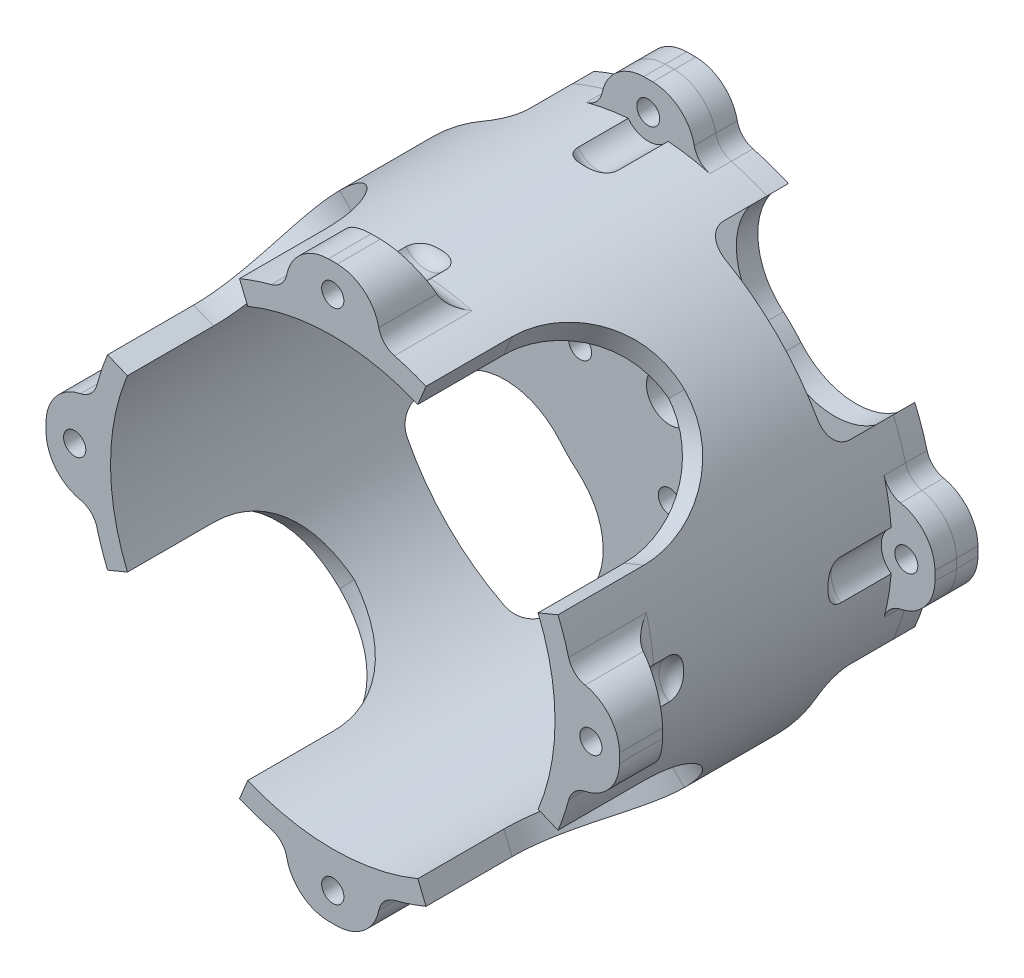
from build123d import *
from build123d.topology import SkipClean

# Parameters (mm, degrees)
SKETCH_3_W                       = 34
SKETCH_3_H                       = 50
SHELL_1_T                        = -3
CUT_EXTRUDE_4_REACH              = 71.369
SKETCH_5_R                       = 3.25
SKETCH_5_R_2                     = 1.6
CUT_EXTRUDE_5_DEPTH              = 12
REVOLVE_2_ANGLE                  = 20
SKETCH_9_R                       = 3.5
CUT_EXTRUDE_1598_DEPTH           = 46
CUT_EXTRUDE_1_REACH              = 71.8
SKETCH_10_R                      = 1.55
CUT_EXTRUDE_START                = -25
CUT_EXTRUDE_9_DEPTH              = 25
FILLET_2_R                       = 13
FILLET_3_R                       = 3
FILLET_4_R                       = 6
FILLET_5_R                       = 3
PATTERN_CIRCULAR_2_COUNT         = 4
FILLET_2_OF_PATTERN_CIRCULAR_2_R = 13
FILLET_3_OF_PATTERN_CIRCULAR_2_R = 3
FILLET_4_OF_PATTERN_CIRCULAR_2_R = 6
SKETCH_14_R                      = 1.6
EXTRUDE_4_DEPTH                  = 6
PATTERN_CIRCULAR_3_COUNT         = 4
EXTRUDE_START                    = -20
EXTRUDE_5_DEPTH                  = 20
FILLET_7_R                       = 2


# Read off the part's stored shape, not the designer's step: 分割1
with BuildPart() as part:
    # 草图3 → 旋转1 (revolve)
    with BuildSketch(Plane(origin=(0, 0, 0), x_dir=(1, 0, 0), z_dir=(0, 1, 0)), mode=Mode.PRIVATE) as revolve_1_sk:
        with Locations((17, 25)):
            Rectangle(SKETCH_3_W, SKETCH_3_H)
    revolve(revolve_1_sk.sketch.rotate(Axis((0, 0, -32.43902439), (0, 0, 1)), 180), axis=Axis((0, 0, -32.43902439), (0, 0, 1)))

    # 抽壳1
    shell_1_openings = [part.faces().sort_by_distance(p)[0] for p in [
        (0, 0, 0),
    ]]
    offset(amount=SHELL_1_T, openings=shell_1_openings, kind=Kind.INTERSECTION)

    # 草图5 → 切除-拉伸4 (cut, up to next)
    with BuildSketch(Plane(origin=(0, 0, -50), x_dir=(-1, 0, 0), z_dir=(0, 0, -1)), mode=Mode.PRIVATE) as cut_extrude_4_sk1:
        Circle(SKETCH_5_R)
    cut_extrude_4_tool1 = extrude(cut_extrude_4_sk1.sketch, amount=-CUT_EXTRUDE_4_REACH, mode=Mode.PRIVATE) & part.part
    # 草图5 → 切除-拉伸4 (cut, up to next)
    with BuildSketch(Plane(origin=(0, 0, -50), x_dir=(-1, 0, 0), z_dir=(0, 0, -1)), mode=Mode.PRIVATE) as cut_extrude_4_sk2:
        with Locations((12.5, 0)):
            Circle(SKETCH_5_R_2)
    cut_extrude_4_tool2 = extrude(cut_extrude_4_sk2.sketch, amount=-CUT_EXTRUDE_4_REACH, mode=Mode.PRIVATE) & part.part
    # 草图5 → 切除-拉伸4 (cut, up to next)
    with BuildSketch(Plane(origin=(0, 0, -50), x_dir=(-1, 0, 0), z_dir=(0, 0, -1)), mode=Mode.PRIVATE) as cut_extrude_4_sk3:
        with Locations((0, -12.5)):
            Circle(SKETCH_5_R_2)
    cut_extrude_4_tool3 = extrude(cut_extrude_4_sk3.sketch, amount=-CUT_EXTRUDE_4_REACH, mode=Mode.PRIVATE) & part.part
    # 草图5 → 切除-拉伸4 (cut, up to next)
    with BuildSketch(Plane(origin=(0, 0, -50), x_dir=(-1, 0, 0), z_dir=(0, 0, -1)), mode=Mode.PRIVATE) as cut_extrude_4_sk4:
        with Locations((-12.5, 0)):
            Circle(SKETCH_5_R_2)
    cut_extrude_4_tool4 = extrude(cut_extrude_4_sk4.sketch, amount=-CUT_EXTRUDE_4_REACH, mode=Mode.PRIVATE) & part.part
    # 草图5 → 切除-拉伸4 (cut, up to next)
    with BuildSketch(Plane(origin=(0, 0, -50), x_dir=(-1, 0, 0), z_dir=(0, 0, -1)), mode=Mode.PRIVATE) as cut_extrude_4_sk5:
        with Locations((0, 12.5)):
            Circle(SKETCH_5_R_2)
    cut_extrude_4_tool5 = extrude(cut_extrude_4_sk5.sketch, amount=-CUT_EXTRUDE_4_REACH, mode=Mode.PRIVATE) & part.part
    add(cut_extrude_4_tool1.solids().sort_by_distance((0, 0, -50))[0], mode=Mode.SUBTRACT)
    add(cut_extrude_4_tool2.solids().sort_by_distance((-12.5, 0, -50))[0], mode=Mode.SUBTRACT)
    add(cut_extrude_4_tool3.solids().sort_by_distance((0, -12.5, -50))[0], mode=Mode.SUBTRACT)
    add(cut_extrude_4_tool4.solids().sort_by_distance((12.5, 0, -50))[0], mode=Mode.SUBTRACT)
    add(cut_extrude_4_tool5.solids().sort_by_distance((0, 12.5, -50))[0], mode=Mode.SUBTRACT)

    # 草图6 → 切除-拉伸5 (cut)
    with BuildSketch(Plane(origin=(0, 0, -50), x_dir=(-1, 0, 0), z_dir=(0, 0, -1))):
        with BuildLine():
            ThreePointArc((30.641777725, 25.711504387), (28.284271247, 28.284271247), (25.711504387, 30.641777725))
            ThreePointArc((25.711504387, 30.641777725), (11.623183859, 29.40920939), (12.855752194, 15.320888862))
            ThreePointArc((12.855752194, 15.320888862), (14.142135624, 14.142135624), (15.320888862, 12.855752194))
            ThreePointArc((15.320888862, 12.855752194), (29.40920939, 11.623183859), (30.641777725, 25.711504387))
        make_face()
        with BuildLine():
            ThreePointArc((12.855752194, -15.320888862), (14.142135624, -14.142135624), (15.320888862, -12.855752194))
            ThreePointArc((15.320888862, -12.855752194), (29.40920939, -11.623183859), (30.641777725, -25.711504387))
            ThreePointArc((30.641777725, -25.711504387), (28.284271247, -28.284271247), (25.711504387, -30.641777725))
            ThreePointArc((25.711504387, -30.641777725), (11.623183859, -29.40920939), (12.855752194, -15.320888862))
        make_face()
        with BuildLine():
            ThreePointArc((-15.320888862, -12.855752194), (-14.142135624, -14.142135624), (-12.855752194, -15.320888862))
            ThreePointArc((-12.855752194, -15.320888862), (-11.623183859, -29.40920939), (-25.711504387, -30.641777725))
            ThreePointArc((-25.711504387, -30.641777725), (-28.284271247, -28.284271247), (-30.641777725, -25.711504387))
            ThreePointArc((-30.641777725, -25.711504387), (-29.40920939, -11.623183859), (-15.320888862, -12.855752194))
        make_face()
        with BuildLine():
            ThreePointArc((-12.855752194, 15.320888862), (-14.142135624, 14.142135624), (-15.320888862, 12.855752194))
            ThreePointArc((-15.320888862, 12.855752194), (-29.40920939, 11.623183859), (-30.641777725, 25.711504387))
            ThreePointArc((-30.641777725, 25.711504387), (-28.284271247, 28.284271247), (-25.711504387, 30.641777725))
            ThreePointArc((-25.711504387, 30.641777725), (-11.623183859, 29.40920939), (-12.855752194, 15.320888862))
        make_face()
    extrude(amount=-CUT_EXTRUDE_5_DEPTH, mode=Mode.SUBTRACT)

    # 草图8 → 旋转2 (revolve, symmetric)
    with BuildSketch(Plane(origin=(0, 0, 0), x_dir=(1, 0, 0), z_dir=(0, 1, 0))) as revolve_2_sk:
        Polygon((40, 0), (32, 0), (32, 10), (40, 6), align=None)
    revolve_2 = revolve(axis=Axis((0, 0, -50), (0, 0, 1)), revolution_arc=REVOLVE_2_ANGLE / 2)
    revolve_2 = revolve_2 + revolve(revolve_2_sk.sketch, axis=Axis((0, 0, -50), (0, 0, -1)), revolution_arc=REVOLVE_2_ANGLE / 2)

    # 草图9 → Cut-Extrude 1598 (cut)
    with BuildSketch(Plane(origin=(0, 0, -50), x_dir=(-1, 0, 0), z_dir=(0, 0, -1))):
        with Locations((-36, 0)):
            Circle(SKETCH_9_R)
    cut_extrude_1598 = extrude(amount=-CUT_EXTRUDE_1598_DEPTH, mode=Mode.SUBTRACT)

    # 草图10 → 1 (cut, up to next)
    with BuildSketch(Plane(origin=(0, 0, -4), x_dir=(-1, 0, 0), z_dir=(0, 0, -1)), mode=Mode.PRIVATE) as cut_extrude_1_sk1:
        with Locations((-36, 0)):
            Circle(SKETCH_10_R)
    cut_extrude_1_tool1 = extrude(cut_extrude_1_sk1.sketch, amount=-CUT_EXTRUDE_1_REACH, mode=Mode.PRIVATE) & part.part
    cut_extrude_1 = cut_extrude_1_tool1.solids().sort_by_distance((36, 0, -4))[0]
    add(cut_extrude_1, mode=Mode.SUBTRACT)

    # 草图13 → 切除-拉伸9 (cut)
    with BuildSketch(Plane.XY.offset(CUT_EXTRUDE_START)):
        with BuildLine():
            Line((13.0112367, 31.411904105), (0, 0))
            Line((0, 0), (31.411904105, 13.0112367))
            ThreePointArc((31.411904105, 13.0112367), (24.04163056, 24.04163056), (13.0112367, 31.411904105))
        make_face()
    cut_extrude_9 = extrude(amount=CUT_EXTRUDE_9_DEPTH, mode=Mode.SUBTRACT)

    # 圆角2
    # the kernel refuses this fillet: 13 mm, written as the material it adds along each edge
    with BuildSketch(Plane(origin=(-1.385819299, -0.574025149, -25), x_dir=(-0.38268343236509067, 0.9238795325112865, 0), z_dir=(0.9238795325112865, 0.3826834323650907, 0))) as fillet_2_piece_1_section:
        with BuildLine():
            CenterArc((FILLET_2_R, FILLET_2_R), FILLET_2_R, 180, 90)
            Line((0, FILLET_2_R), (0, 0))
            Line((0, 0), (FILLET_2_R, 0))
        make_face()
    fillet_2_piece_1 = extrude(amount=68, mode=Mode.PRIVATE)
    fillet_2_piece_1 = fillet_2_piece_1 & Plane(origin=(0, 0, -22.074551824), x_dir=(-1, 0, 0), z_dir=(0, 0, -1)) * Cylinder(34, 189, mode=Mode.PRIVATE)
    fillet_2_piece_1 = fillet_2_piece_1 - Plane(origin=(0, 0, -22.074551824), x_dir=(-1, 0, 0), z_dir=(0, 0, -1)) * Cylinder(31, 189, mode=Mode.PRIVATE)
    add(fillet_2_piece_1)
    with BuildSketch(Plane(origin=(25.448448252, 61.437988912, -25), x_dir=(0, 0, 1), z_dir=(-0.38268343236508723, -0.923879532511288, 0))) as fillet_2_piece_2_section:
        with BuildLine():
            CenterArc((FILLET_2_R, -FILLET_2_R), FILLET_2_R, 90, 90)
            Line((0, -FILLET_2_R), (0, 0))
            Line((0, 0), (FILLET_2_R, 0))
        make_face()
    fillet_2_piece_2 = extrude(amount=68, mode=Mode.PRIVATE)
    fillet_2_piece_2 = fillet_2_piece_2 & Plane(origin=(0, 0, -22.074550879), x_dir=(-1, 0, 0), z_dir=(0, 0, -1)) * Cylinder(34, 189, mode=Mode.PRIVATE)
    fillet_2_piece_2 = fillet_2_piece_2 - Plane(origin=(0, 0, -22.074550879), x_dir=(-1, 0, 0), z_dir=(0, 0, -1)) * Cylinder(31, 189, mode=Mode.PRIVATE)
    add(fillet_2_piece_2)

    # 圆角3
    fillet_3_edges = [part.edges().sort_by_distance(p)[0] for p in [
        (33.483463602, -5.904038041, -4.5),
        (33.720429536, -4.351164428, -9),
        (33.720429536, 4.351164428, -9),
        (33.483463602, 5.904038041, -4.5),
    ]]
    fillet(fillet_3_edges, radius=FILLET_3_R)

    # 圆角4
    fillet_4_edges = [part.edges().sort_by_distance(p)[0] for p in [
        (39.39231012, -6.945927107, -3),
        (39.39231012, 6.945927107, -3),
    ]]
    fillet(fillet_4_edges, radius=FILLET_4_R)

    # 圆角5
    fillet_5_edges = [part.edges().sort_by_distance(p)[0] for p in [
        (12.295929357, 30.134798441, -38),
        (30.134798441, 12.295929357, -38),
        (30.134798441, -12.295929357, -38),
        (12.295929357, -30.134798441, -38),
        (-12.295929357, -30.134798441, -38),
        (-30.134798441, -12.295929357, -38),
        (-30.134798441, 12.295929357, -38),
        (-12.295929357, 30.134798441, -38),
    ]]
    fillet(fillet_5_edges, radius=FILLET_5_R)

    # 阵列(圆周)2: 旋转2, Cut-Extrude 1598, 1, 切除-拉伸9 ×4 about axis
    pattern_circular_2_axis = Axis((0, 0, 0), (0, 0, 1))
    add([revolve_2.rotate(pattern_circular_2_axis, i * 360 / PATTERN_CIRCULAR_2_COUNT) for i in range(1, PATTERN_CIRCULAR_2_COUNT)])
    add([cut_extrude_1598.rotate(pattern_circular_2_axis, i * 360 / PATTERN_CIRCULAR_2_COUNT) for i in range(1, PATTERN_CIRCULAR_2_COUNT)], mode=Mode.SUBTRACT)
    add([cut_extrude_1.rotate(pattern_circular_2_axis, i * 360 / PATTERN_CIRCULAR_2_COUNT) for i in range(1, PATTERN_CIRCULAR_2_COUNT)], mode=Mode.SUBTRACT)
    add([cut_extrude_9.rotate(pattern_circular_2_axis, i * 360 / PATTERN_CIRCULAR_2_COUNT) for i in range(1, PATTERN_CIRCULAR_2_COUNT)], mode=Mode.SUBTRACT)

    # 圆角2 of 阵列(圆周)2
    # the kernel refuses this fillet: 13 mm, written as the material it adds along each edge
    with BuildSketch(Plane(origin=(0.574025149, -1.385819299, -25), x_dir=(0, 0, 1), z_dir=(-0.3826834323650906, 0.9238795325112865, 0))) as fillet_2_of_pattern_circular_2_piece_1_section:
        with BuildLine():
            CenterArc((FILLET_2_OF_PATTERN_CIRCULAR_2_R, -FILLET_2_OF_PATTERN_CIRCULAR_2_R), FILLET_2_OF_PATTERN_CIRCULAR_2_R, 90, 90)
            Line((0, -FILLET_2_OF_PATTERN_CIRCULAR_2_R), (0, 0))
            Line((0, 0), (FILLET_2_OF_PATTERN_CIRCULAR_2_R, 0))
        make_face()
    fillet_2_of_pattern_circular_2_piece_1 = extrude(amount=68, mode=Mode.PRIVATE)
    fillet_2_of_pattern_circular_2_piece_1 = fillet_2_of_pattern_circular_2_piece_1 - Plane(origin=(0, 0, -22.074550002), x_dir=(-1, 0, 0), z_dir=(0, 0, -1)) * Cylinder(31, 188, mode=Mode.PRIVATE)
    fillet_2_of_pattern_circular_2_piece_1 = fillet_2_of_pattern_circular_2_piece_1 & Plane(origin=(0, 0, -22.074550002), x_dir=(-1, 0, 0), z_dir=(0, 0, -1)) * Cylinder(34, 188, mode=Mode.PRIVATE)
    add(fillet_2_of_pattern_circular_2_piece_1)
    with BuildSketch(Plane(origin=(-61.437988912, 25.448448252, -25), x_dir=(0, 0, 1), z_dir=(0.923879532511288, -0.38268343236508734, 0))) as fillet_2_of_pattern_circular_2_piece_2_section:
        with BuildLine():
            CenterArc((FILLET_2_OF_PATTERN_CIRCULAR_2_R, -FILLET_2_OF_PATTERN_CIRCULAR_2_R), FILLET_2_OF_PATTERN_CIRCULAR_2_R, 90, 90)
            Line((0, -FILLET_2_OF_PATTERN_CIRCULAR_2_R), (0, 0))
            Line((0, 0), (FILLET_2_OF_PATTERN_CIRCULAR_2_R, 0))
        make_face()
    fillet_2_of_pattern_circular_2_piece_2 = extrude(amount=68, mode=Mode.PRIVATE)
    fillet_2_of_pattern_circular_2_piece_2 = fillet_2_of_pattern_circular_2_piece_2 - Plane(origin=(0, 0, -22.07455132), x_dir=(-1, 0, 0), z_dir=(0, 0, -1)) * Cylinder(31, 189, mode=Mode.PRIVATE)
    fillet_2_of_pattern_circular_2_piece_2 = fillet_2_of_pattern_circular_2_piece_2 & Plane(origin=(0, 0, -22.07455132), x_dir=(-1, 0, 0), z_dir=(0, 0, -1)) * Cylinder(34, 189, mode=Mode.PRIVATE)
    add(fillet_2_of_pattern_circular_2_piece_2)
    with BuildSketch(Plane(origin=(1.385819299, 0.574025149, -25), x_dir=(0.3826834323650905, -0.9238795325112864, 0), z_dir=(-0.9238795325112865, -0.3826834323650906, 0))) as fillet_2_of_pattern_circular_2_piece_3_section:
        with BuildLine():
            CenterArc((FILLET_2_OF_PATTERN_CIRCULAR_2_R, FILLET_2_OF_PATTERN_CIRCULAR_2_R), FILLET_2_OF_PATTERN_CIRCULAR_2_R, 180, 90)
            Line((0, FILLET_2_OF_PATTERN_CIRCULAR_2_R), (0, 0))
            Line((0, 0), (FILLET_2_OF_PATTERN_CIRCULAR_2_R, 0))
        make_face()
    fillet_2_of_pattern_circular_2_piece_3 = extrude(amount=68, mode=Mode.PRIVATE)
    fillet_2_of_pattern_circular_2_piece_3 = fillet_2_of_pattern_circular_2_piece_3 - Plane(origin=(0, 0, -22.074551836), x_dir=(-1, 0, 0), z_dir=(0, 0, -1)) * Cylinder(31, 189, mode=Mode.PRIVATE)
    fillet_2_of_pattern_circular_2_piece_3 = fillet_2_of_pattern_circular_2_piece_3 & Plane(origin=(0, 0, -22.074551836), x_dir=(-1, 0, 0), z_dir=(0, 0, -1)) * Cylinder(34, 189, mode=Mode.PRIVATE)
    add(fillet_2_of_pattern_circular_2_piece_3)
    with BuildSketch(Plane(origin=(-25.448448252, -61.437988912, -25), x_dir=(0, 0, 1), z_dir=(0.38268343236508723, 0.9238795325112877, 0))) as fillet_2_of_pattern_circular_2_piece_4_section:
        with BuildLine():
            CenterArc((FILLET_2_OF_PATTERN_CIRCULAR_2_R, -FILLET_2_OF_PATTERN_CIRCULAR_2_R), FILLET_2_OF_PATTERN_CIRCULAR_2_R, 90, 90)
            Line((0, -FILLET_2_OF_PATTERN_CIRCULAR_2_R), (0, 0))
            Line((0, 0), (FILLET_2_OF_PATTERN_CIRCULAR_2_R, 0))
        make_face()
    fillet_2_of_pattern_circular_2_piece_4 = extrude(amount=68, mode=Mode.PRIVATE)
    fillet_2_of_pattern_circular_2_piece_4 = fillet_2_of_pattern_circular_2_piece_4 - Plane(origin=(0, 0, -22.074551321), x_dir=(-1, 0, 0), z_dir=(0, 0, -1)) * Cylinder(31, 189, mode=Mode.PRIVATE)
    fillet_2_of_pattern_circular_2_piece_4 = fillet_2_of_pattern_circular_2_piece_4 & Plane(origin=(0, 0, -22.074551321), x_dir=(-1, 0, 0), z_dir=(0, 0, -1)) * Cylinder(34, 189, mode=Mode.PRIVATE)
    add(fillet_2_of_pattern_circular_2_piece_4)
    with BuildSketch(Plane(origin=(-0.574025149, 1.385819299, -25), x_dir=(0.9238795325112865, 0.38268343236509045, 0), z_dir=(0.3826834323650905, -0.9238795325112866, 0))) as fillet_2_of_pattern_circular_2_piece_5_section:
        with BuildLine():
            CenterArc((FILLET_2_OF_PATTERN_CIRCULAR_2_R, FILLET_2_OF_PATTERN_CIRCULAR_2_R), FILLET_2_OF_PATTERN_CIRCULAR_2_R, 180, 90)
            Line((0, FILLET_2_OF_PATTERN_CIRCULAR_2_R), (0, 0))
            Line((0, 0), (FILLET_2_OF_PATTERN_CIRCULAR_2_R, 0))
        make_face()
    fillet_2_of_pattern_circular_2_piece_5 = extrude(amount=68, mode=Mode.PRIVATE)
    fillet_2_of_pattern_circular_2_piece_5 = fillet_2_of_pattern_circular_2_piece_5 - Plane(origin=(0, 0, -22.074551836), x_dir=(-1, 0, 0), z_dir=(0, 0, -1)) * Cylinder(31, 189, mode=Mode.PRIVATE)
    fillet_2_of_pattern_circular_2_piece_5 = fillet_2_of_pattern_circular_2_piece_5 & Plane(origin=(0, 0, -22.074551836), x_dir=(-1, 0, 0), z_dir=(0, 0, -1)) * Cylinder(34, 189, mode=Mode.PRIVATE)
    add(fillet_2_of_pattern_circular_2_piece_5)
    with BuildSketch(Plane(origin=(61.437988912, -25.448448252, -25), x_dir=(0, 0, 1), z_dir=(-0.9238795325112878, 0.38268343236508745, 0))) as fillet_2_of_pattern_circular_2_piece_6_section:
        with BuildLine():
            CenterArc((FILLET_2_OF_PATTERN_CIRCULAR_2_R, -FILLET_2_OF_PATTERN_CIRCULAR_2_R), FILLET_2_OF_PATTERN_CIRCULAR_2_R, 90, 90)
            Line((0, -FILLET_2_OF_PATTERN_CIRCULAR_2_R), (0, 0))
            Line((0, 0), (FILLET_2_OF_PATTERN_CIRCULAR_2_R, 0))
        make_face()
    fillet_2_of_pattern_circular_2_piece_6 = extrude(amount=68, mode=Mode.PRIVATE)
    fillet_2_of_pattern_circular_2_piece_6 = fillet_2_of_pattern_circular_2_piece_6 - Plane(origin=(0, 0, -22.07455132), x_dir=(-1, 0, 0), z_dir=(0, 0, -1)) * Cylinder(31, 189, mode=Mode.PRIVATE)
    fillet_2_of_pattern_circular_2_piece_6 = fillet_2_of_pattern_circular_2_piece_6 & Plane(origin=(0, 0, -22.07455132), x_dir=(-1, 0, 0), z_dir=(0, 0, -1)) * Cylinder(34, 189, mode=Mode.PRIVATE)
    add(fillet_2_of_pattern_circular_2_piece_6)

    # 圆角3 of 阵列(圆周)2
    fillet_3_of_pattern_circular_2_edges = [part.edges().sort_by_distance(p)[0] for p in [
        (5.904038041, 33.483463602, -4.5),
        (4.351164428, 33.720429536, -9),
        (-4.351164428, 33.720429536, -9),
        (-5.904038041, 33.483463602, -4.5),
        (-33.483463602, 5.904038041, -4.5),
        (-33.720429536, 4.351164428, -9),
        (-33.720429536, -4.351164428, -9),
        (-33.483463602, -5.904038041, -4.5),
        (-5.904038041, -33.483463602, -4.5),
        (-4.351164428, -33.720429536, -9),
        (4.351164428, -33.720429536, -9),
        (5.904038041, -33.483463602, -4.5),
    ]]
    fillet(fillet_3_of_pattern_circular_2_edges, radius=FILLET_3_OF_PATTERN_CIRCULAR_2_R)

    # 圆角4 of 阵列(圆周)2
    fillet_4_of_pattern_circular_2_edges = [part.edges().sort_by_distance(p)[0] for p in [
        (6.945927107, 39.39231012, -3),
        (-6.945927107, 39.39231012, -3),
        (-39.39231012, 6.945927107, -3),
        (-39.39231012, -6.945927107, -3),
        (-6.945927107, -39.39231012, -3),
        (6.945927107, -39.39231012, -3),
    ]]
    fillet(fillet_4_of_pattern_circular_2_edges, radius=FILLET_4_OF_PATTERN_CIRCULAR_2_R)

    # 草图14 → 凸台-拉伸4 (add)
    with BuildSketch(Plane(origin=(0, 0, -50), x_dir=(-1, 0, 0), z_dir=(0, 0, -1))):
        with BuildLine():
            Line((0.635702185, 39.994948215), (-0.635702185, 39.994948215))
            ThreePointArc((-0.635702185, 39.994948215), (-4.371561181, 38.613259102), (-6.418950042, 35.196549268))
            ThreePointArc((-6.418950042, 35.196549268), (-6.432552954, 35.133429479), (-6.447511162, 35.070617069))
            ThreePointArc((-6.447511162, 35.070617069), (-7.22513273, 33.687515118), (-8.599474475, 32.894513809))
            ThreePointArc((-8.599474475, 32.894513809), (-5.715752488, 33.516118115), (-2.789002927, 33.885416667))
            ThreePointArc((-2.789002927, 33.885416667), (0, 32.5), (2.789002927, 33.885416667))
            ThreePointArc((2.789002927, 33.885416667), (5.715752488, 33.516118115), (8.599474475, 32.894513809))
            ThreePointArc((8.599474475, 32.894513809), (7.22513273, 33.687515118), (6.447511162, 35.070617069))
            ThreePointArc((6.447511162, 35.070617069), (6.432552954, 35.133429479), (6.418950042, 35.196549268))
            ThreePointArc((6.418950042, 35.196549268), (4.371561181, 38.613259102), (0.635702185, 39.994948215))
        make_face()
        with Locations((0, 36)):
            Circle(SKETCH_14_R, mode=Mode.SUBTRACT)
    extrude_4 = extrude(amount=-EXTRUDE_4_DEPTH)

    # 阵列(圆周)3: 凸台-拉伸4 ×4 about axis
    pattern_circular_3_axis = Axis((0, 0, 0), (0, 0, 1))
    for i in range(1, PATTERN_CIRCULAR_3_COUNT):
        add(extrude_4.rotate(pattern_circular_3_axis, i * 360 / PATTERN_CIRCULAR_3_COUNT))

    # 草图15 → 凸台-拉伸5 (add)
    with SkipClean():  # the faces are left unmerged after this step: merging them gives an invalid solid
        with BuildSketch(Plane.XY.offset(-15).offset(EXTRUDE_START)):
            with BuildLine():
                ThreePointArc((-2.789002927, 33.885416667), (0, 32.5), (2.789002927, 33.885416667))
                ThreePointArc((2.789002927, 33.885416667), (0, 34), (-2.789002927, 33.885416667))
            make_face()
            with BuildLine():
                ThreePointArc((33.885416667, -2.789002927), (33.971342089, -1.395677852), (34, 0))
                ThreePointArc((34, 0), (33.971342089, 1.395677852), (33.885416667, 2.789002927))
                ThreePointArc((33.885416667, 2.789002927), (32.5, 0), (33.885416667, -2.789002927))
            make_face()
            with BuildLine():
                ThreePointArc((-33.885416667, -2.789002927), (-32.5, 0), (-33.885416667, 2.789002927))
                ThreePointArc((-33.885416667, 2.789002927), (-34, 0), (-33.885416667, -2.789002927))
            make_face()
            with BuildLine():
                ThreePointArc((-2.789002927, -33.885416667), (0, -34), (2.789002927, -33.885416667))
                ThreePointArc((2.789002927, -33.885416667), (0, -32.5), (-2.789002927, -33.885416667))
            make_face()
        extrude(amount=EXTRUDE_5_DEPTH)


with BuildPart() as body_2:
    # Split Bodies 1: the piece on the far side of the plane
    add(part.part)
    split(bisect_by=Plane.XY.offset(-47), keep=Keep.BOTTOM)


with BuildPart() as part_1:
    add(part.part)

    # Split Bodies 1
    split(bisect_by=Plane.XY.offset(-47), keep=Keep.TOP)

    # 圆角7
    # the kernel refuses this fillet: 2 mm, written as the material it adds along each edge
    with BuildSketch(Plane(origin=(0, 36, -35), x_dir=(0, -1, 0), z_dir=(-1, 0, 0))) as fillet_7_piece_1_section:
        with BuildLine():
            CenterArc((3.5 - FILLET_7_R, -FILLET_7_R), FILLET_7_R, 0, 90)
            Line((3.5 - FILLET_7_R, 0), (3.5, 0))
            Line((3.5, 0), (3.5, -FILLET_7_R))
        make_face()
    fillet_7_piece_1 = revolve(axis=Axis((0, 36, -35), (0, 0, 1)), revolution_arc=134.693541837, mode=Mode.PRIVATE)
    fillet_7_piece_1 = fillet_7_piece_1 & Plane(origin=(0, 0, -35.530408518), x_dir=(-1, 0, 0), z_dir=(0, 0, -1)) * Cylinder(34, 15, mode=Mode.PRIVATE)
    add(fillet_7_piece_1)
    with BuildSketch(Plane(origin=(-36, 0, -35), x_dir=(1, 0, 0), z_dir=(0, -1, 0))) as fillet_7_piece_2_section:
        with BuildLine():
            CenterArc((3.5 - FILLET_7_R, -FILLET_7_R), FILLET_7_R, 0, 90)
            Line((3.5 - FILLET_7_R, 0), (3.5, 0))
            Line((3.5, 0), (3.5, -FILLET_7_R))
        make_face()
    fillet_7_piece_2 = revolve(axis=Axis((-36, 0, -35), (0, 0, 1)), revolution_arc=134.693541837, mode=Mode.PRIVATE)
    fillet_7_piece_2 = fillet_7_piece_2 & Plane(origin=(0, 0, -35.530408705), x_dir=(-0.9966299019607846, 0.08202949785069409, 0), z_dir=(0, 0, -1)) * Cylinder(34, 14, mode=Mode.PRIVATE)
    add(fillet_7_piece_2)
    with BuildSketch(Plane(origin=(0, -36, -35), x_dir=(0, 1, 0), z_dir=(1, 0, 0))) as fillet_7_piece_3_section:
        with BuildLine():
            CenterArc((3.5 - FILLET_7_R, -FILLET_7_R), FILLET_7_R, 0, 90)
            Line((3.5 - FILLET_7_R, 0), (3.5, 0))
            Line((3.5, 0), (3.5, -FILLET_7_R))
        make_face()
    fillet_7_piece_3 = revolve(axis=Axis((0, -36, -35), (0, 0, 1)), revolution_arc=134.693541837, mode=Mode.PRIVATE)
    fillet_7_piece_3 = fillet_7_piece_3 & Plane(origin=(0, 0, -35.530408518), x_dir=(-1, 0, 0), z_dir=(0, 0, -1)) * Cylinder(34, 14, mode=Mode.PRIVATE)
    add(fillet_7_piece_3)
    with BuildSketch(Plane(origin=(0, -36, -15), x_dir=(0, 1, 0), z_dir=(1, 0, 0))) as fillet_7_piece_4_section:
        with BuildLine():
            CenterArc((3.5 - FILLET_7_R, FILLET_7_R), FILLET_7_R, 270, 90)
            Line((3.5 - FILLET_7_R, 0), (3.5, 0))
            Line((3.5, 0), (3.5, FILLET_7_R))
        make_face()
    fillet_7_piece_4 = revolve(axis=Axis((0, -36, -15), (0, 0, 1)), revolution_arc=134.693541837, mode=Mode.PRIVATE)
    fillet_7_piece_4 = fillet_7_piece_4 & Plane(origin=(0, 0, -14.469591482), x_dir=(-1, 0, 0), z_dir=(0, 0, -1)) * Cylinder(34, 14, mode=Mode.PRIVATE)
    add(fillet_7_piece_4)
    with BuildSketch(Plane(origin=(36, 0, -35), x_dir=(0.7033145797167303, 0.7108787533453781, 0), z_dir=(0.7108787533453781, -0.7033145797167303, 0))) as fillet_7_piece_5_section:
        with BuildLine():
            CenterArc((3.5 - FILLET_7_R, -FILLET_7_R), FILLET_7_R, 0, 90)
            Line((3.5, -FILLET_7_R), (3.5, 0))
            Line((3.5, 0), (3.5 - FILLET_7_R, 0))
        make_face()
    fillet_7_piece_5 = revolve(axis=Axis((36, 0, -35), (0, 0, 1)), revolution_arc=134.693541837, mode=Mode.PRIVATE)
    fillet_7_piece_5 = fillet_7_piece_5 & Plane(origin=(0, 0, -35.530408671), x_dir=(0.996629901960784, -0.08202949785069949, 0), z_dir=(0, 0, -1)) * Cylinder(34, 15, mode=Mode.PRIVATE)
    add(fillet_7_piece_5)
    with BuildSketch(Plane(origin=(36, 0, -15), x_dir=(0.7033145797167303, 0.7108787533453781, 0), z_dir=(0.7108787533453781, -0.7033145797167303, 0))) as fillet_7_piece_6_section:
        with BuildLine():
            CenterArc((3.5 - FILLET_7_R, FILLET_7_R), FILLET_7_R, 270, 90)
            Line((3.5 - FILLET_7_R, 0), (3.5, 0))
            Line((3.5, 0), (3.5, FILLET_7_R))
        make_face()
    fillet_7_piece_6 = revolve(axis=Axis((36, 0, -15), (0, 0, 1)), revolution_arc=134.693541837, mode=Mode.PRIVATE)
    fillet_7_piece_6 = fillet_7_piece_6 & Plane(origin=(0, 0, -14.469591135), x_dir=(-1, 0, 0), z_dir=(0, 0, -1)) * Cylinder(34, 15, mode=Mode.PRIVATE)
    add(fillet_7_piece_6)
    with BuildSketch(Plane(origin=(0, 36, -15), x_dir=(0, -1, 0), z_dir=(-1, 0, 0))) as fillet_7_piece_7_section:
        with BuildLine():
            CenterArc((3.5 - FILLET_7_R, FILLET_7_R), FILLET_7_R, 270, 90)
            Line((3.5 - FILLET_7_R, 0), (3.5, 0))
            Line((3.5, 0), (3.5, FILLET_7_R))
        make_face()
    fillet_7_piece_7 = revolve(axis=Axis((0, 36, -15), (0, 0, 1)), revolution_arc=134.693541837, mode=Mode.PRIVATE)
    fillet_7_piece_7 = fillet_7_piece_7 & Plane(origin=(0, 0, -14.469591482), x_dir=(-1, 0, 0), z_dir=(0, 0, -1)) * Cylinder(34, 15, mode=Mode.PRIVATE)
    add(fillet_7_piece_7)
    with BuildSketch(Plane(origin=(-36, 0, -15), x_dir=(1, 0, 0), z_dir=(0, -1, 0))) as fillet_7_piece_8_section:
        with BuildLine():
            CenterArc((3.5 - FILLET_7_R, FILLET_7_R), FILLET_7_R, 270, 90)
            Line((3.5 - FILLET_7_R, 0), (3.5, 0))
            Line((3.5, 0), (3.5, FILLET_7_R))
        make_face()
    fillet_7_piece_8 = revolve(axis=Axis((-36, 0, -15), (0, 0, 1)), revolution_arc=134.693541837, mode=Mode.PRIVATE)
    fillet_7_piece_8 = fillet_7_piece_8 & Plane(origin=(0, 0, -14.469591295), x_dir=(-0.9966299019607846, 0.08202949785069409, 0), z_dir=(0, 0, -1)) * Cylinder(34, 14, mode=Mode.PRIVATE)
    add(fillet_7_piece_8)
    with BuildSketch(Plane(origin=(-36, 0, -15), x_dir=(-0.7033145797169008, -0.7108787533452094, 0), z_dir=(-0.7108787533452094, 0.7033145797169008, 0))) as fillet_7_piece_9_section:
        with BuildLine():
            CenterArc((3.5 - FILLET_7_R, FILLET_7_R), FILLET_7_R, 270, 90)
            Line((3.5 - FILLET_7_R, 0), (3.5, 0))
            Line((3.5, 0), (3.5, FILLET_7_R))
        make_face()
    fillet_7_piece_9 = revolve(axis=Axis((-36, 0, -15), (0, 0, 1)), revolution_arc=134.693541837, mode=Mode.PRIVATE)
    fillet_7_piece_9 = fillet_7_piece_9 & Plane(origin=(0, 0, -14.469591135), x_dir=(-1, 0, 0), z_dir=(0, 0, -1)) * Cylinder(34, 15, mode=Mode.PRIVATE)
    add(fillet_7_piece_9)
    with BuildSketch(Plane(origin=(0, 36, -15), x_dir=(-0.7108787533453707, 0.7033145797167378, 0), z_dir=(0.7033145797167378, 0.7108787533453707, 0))) as fillet_7_piece_10_section:
        with BuildLine():
            CenterArc((3.5 - FILLET_7_R, FILLET_7_R), FILLET_7_R, 270, 90)
            Line((3.5 - FILLET_7_R, 0), (3.5, 0))
            Line((3.5, 0), (3.5, FILLET_7_R))
        make_face()
    fillet_7_piece_10 = revolve(axis=Axis((0, 36, -15), (0, 0, 1)), revolution_arc=134.693541837, mode=Mode.PRIVATE)
    fillet_7_piece_10 = fillet_7_piece_10 & Plane(origin=(0, 0, -14.469591135), x_dir=(-1, 0, 0), z_dir=(0, 0, -1)) * Cylinder(34, 15, mode=Mode.PRIVATE)
    add(fillet_7_piece_10)
    with BuildSketch(Plane(origin=(36, 0, -15), x_dir=(-1, 0, 0), z_dir=(0, 1, 0))) as fillet_7_piece_11_section:
        with BuildLine():
            CenterArc((3.5 - FILLET_7_R, FILLET_7_R), FILLET_7_R, 270, 90)
            Line((3.5 - FILLET_7_R, 0), (3.5, 0))
            Line((3.5, 0), (3.5, FILLET_7_R))
        make_face()
    fillet_7_piece_11 = revolve(axis=Axis((36, 0, -15), (0, 0, 1)), revolution_arc=134.693541837, mode=Mode.PRIVATE)
    fillet_7_piece_11 = fillet_7_piece_11 & Plane(origin=(0, 0, -14.469591482), x_dir=(-1, 0, 0), z_dir=(0, 0, -1)) * Cylinder(34, 14, mode=Mode.PRIVATE)
    add(fillet_7_piece_11)
    with BuildSketch(Plane(origin=(36, 0, -35), x_dir=(-1, 0, 0), z_dir=(0, 1, 0))) as fillet_7_piece_12_section:
        with BuildLine():
            CenterArc((3.5 - FILLET_7_R, -FILLET_7_R), FILLET_7_R, 0, 90)
            Line((3.5 - FILLET_7_R, 0), (3.5, 0))
            Line((3.5, 0), (3.5, -FILLET_7_R))
        make_face()
    fillet_7_piece_12 = revolve(axis=Axis((36, 0, -35), (0, 0, 1)), revolution_arc=134.693541837, mode=Mode.PRIVATE)
    fillet_7_piece_12 = fillet_7_piece_12 & Plane(origin=(0, 0, -35.530408518), x_dir=(-1, 0, 0), z_dir=(0, 0, -1)) * Cylinder(34, 14, mode=Mode.PRIVATE)
    add(fillet_7_piece_12)
    with BuildSketch(Plane(origin=(0, -36, -15), x_dir=(0.7108787533452046, -0.7033145797169058, 0), z_dir=(-0.7033145797169058, -0.7108787533452046, 0))) as fillet_7_piece_13_section:
        with BuildLine():
            CenterArc((3.5 - FILLET_7_R, FILLET_7_R), FILLET_7_R, 270, 90)
            Line((3.5 - FILLET_7_R, 0), (3.5, 0))
            Line((3.5, 0), (3.5, FILLET_7_R))
        make_face()
    fillet_7_piece_13 = revolve(axis=Axis((0, -36, -15), (0, 0, 1)), revolution_arc=134.693541837, mode=Mode.PRIVATE)
    fillet_7_piece_13 = fillet_7_piece_13 & Plane(origin=(0, 0, -14.469591135), x_dir=(-1, 0, 0), z_dir=(0, 0, -1)) * Cylinder(34, 15, mode=Mode.PRIVATE)
    add(fillet_7_piece_13)
    with BuildSketch(Plane(origin=(0, -36, -35), x_dir=(0.7108787533452046, -0.7033145797169058, 0), z_dir=(-0.7033145797169058, -0.7108787533452046, 0))) as fillet_7_piece_14_section:
        with BuildLine():
            CenterArc((3.5 - FILLET_7_R, -FILLET_7_R), FILLET_7_R, 0, 90)
            Line((3.5 - FILLET_7_R, 0), (3.5, 0))
            Line((3.5, 0), (3.5, -FILLET_7_R))
        make_face()
    fillet_7_piece_14 = revolve(axis=Axis((0, -36, -35), (0, 0, 1)), revolution_arc=134.693541837, mode=Mode.PRIVATE)
    fillet_7_piece_14 = fillet_7_piece_14 & Plane(origin=(0, 0, -35.530408865), x_dir=(-1, 0, 0), z_dir=(0, 0, -1)) * Cylinder(34, 15, mode=Mode.PRIVATE)
    add(fillet_7_piece_14)
    with BuildSketch(Plane(origin=(-36, 0, -35), x_dir=(-0.7033145797169008, -0.7108787533452094, 0), z_dir=(-0.7108787533452094, 0.7033145797169008, 0))) as fillet_7_piece_15_section:
        with BuildLine():
            CenterArc((3.5 - FILLET_7_R, -FILLET_7_R), FILLET_7_R, 0, 90)
            Line((3.5 - FILLET_7_R, 0), (3.5, 0))
            Line((3.5, 0), (3.5, -FILLET_7_R))
        make_face()
    fillet_7_piece_15 = revolve(axis=Axis((-36, 0, -35), (0, 0, 1)), revolution_arc=134.693541837, mode=Mode.PRIVATE)
    fillet_7_piece_15 = fillet_7_piece_15 & Plane(origin=(0, 0, -35.530408865), x_dir=(-1, 0, 0), z_dir=(0, 0, -1)) * Cylinder(34, 15, mode=Mode.PRIVATE)
    add(fillet_7_piece_15)
    with BuildSketch(Plane(origin=(0, 36, -35), x_dir=(-0.7108787533453707, 0.7033145797167378, 0), z_dir=(0.7033145797167378, 0.7108787533453707, 0))) as fillet_7_piece_16_section:
        with BuildLine():
            CenterArc((3.5 - FILLET_7_R, -FILLET_7_R), FILLET_7_R, 0, 90)
            Line((3.5 - FILLET_7_R, 0), (3.5, 0))
            Line((3.5, 0), (3.5, -FILLET_7_R))
        make_face()
    fillet_7_piece_16 = revolve(axis=Axis((0, 36, -35), (0, 0, 1)), revolution_arc=134.693541837, mode=Mode.PRIVATE)
    fillet_7_piece_16 = fillet_7_piece_16 & Plane(origin=(0, 0, -35.530408865), x_dir=(-1, 0, 0), z_dir=(0, 0, -1)) * Cylinder(34, 15, mode=Mode.PRIVATE)
    add(fillet_7_piece_16)


solid = Compound([body_2.part, part_1.part])
